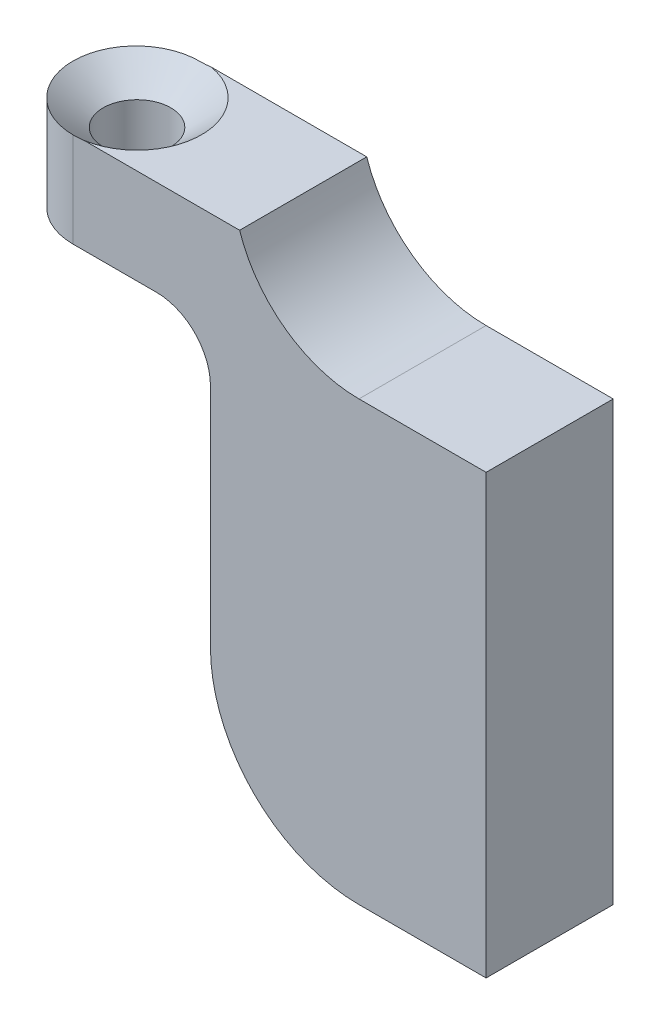
from build123d import *

# Parameters (mm, degrees)
BOSS_EXTRUDE1_DEPTH                                 = 12.7
CSK_FOR_1_4_FLAT_HEAD_MACHINE_SCREW_100_D           = 6.7564
CSK_FOR_1_4_FLAT_HEAD_MACHINE_SCREW_100_CSINK_D     = 12.8778
CSK_FOR_1_4_FLAT_HEAD_MACHINE_SCREW_100_CSINK_ANGLE = 100
FILLET1_R                                           = 6.35


with BuildPart() as part:
    # Sketch1 → Boss-Extrude1 (new body)
    with BuildSketch(Plane.XY):
        with BuildLine():
            Line((0, 0), (0, 43.753600343))
            Line((0, 43.753600343), (-12.7, 43.753600343))
            ThreePointArc((-12.7, 43.753600343), (-20.061287028, 46.138664723), (-24.625181908, 52.3875))
            Line((-24.625181908, 52.3875), (-47.625, 52.3875))
            Line((-47.625, 52.3875), (-47.625, 42.8625))
            Line((-47.625, 42.8625), (-32.935820687, 42.8625))
            ThreePointArc((-32.935820687, 42.8625), (-29.120714859, 41.282231424), (-27.540446284, 37.467125597))
            Line((-27.540446284, 37.467125597), (-27.540446284, 14.840446284))
            ThreePointArc((-27.540446284, 14.840446284), (-23.193780203, 4.346666081), (-12.7, 0))
            Line((-12.7, 0), (0, 0))
        make_face()
    extrude(amount=BOSS_EXTRUDE1_DEPTH)

    # CSK for 1/4 Flat Head Machine Screw (100)1 (through all)
    with Locations(Plane(origin=(0, 52.3875, 0), x_dir=(1, 0, 0), z_dir=(0, 1, 0))):
        with Locations((-41.2242, -6.35)):
            CounterSinkHole(CSK_FOR_1_4_FLAT_HEAD_MACHINE_SCREW_100_D / 2, CSK_FOR_1_4_FLAT_HEAD_MACHINE_SCREW_100_CSINK_D / 2, counter_sink_angle=CSK_FOR_1_4_FLAT_HEAD_MACHINE_SCREW_100_CSINK_ANGLE)

    # Fillet1
    fillet1_edges = [part.edges().sort_by_distance(p)[0] for p in [
        (-47.625, 47.625, 0),
        (-47.625, 47.625, 12.7),
    ]]
    fillet(fillet1_edges, radius=FILLET1_R - 0.0001)  # a hair under: the kernel refuses the full size


solid = part.part
